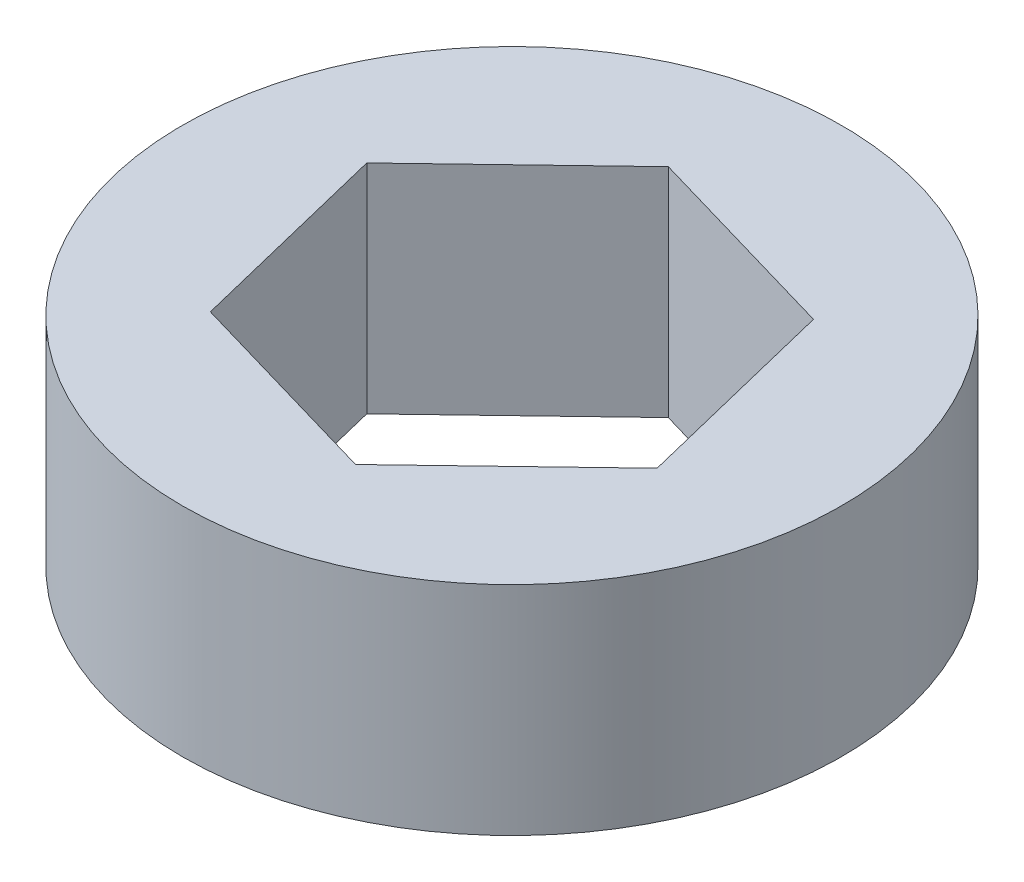
from build123d import *

# Parameters (mm, degrees)
SKETCH1_R           = 4.55
BOSS_EXTRUDE1_DEPTH = 3
CUT_EXTRUDE1_DEPTH  = 15


with BuildPart() as part:
    # Sketch1 → Boss-Extrude1 (new body)
    with BuildSketch(Plane(origin=(0, 0, 0), x_dir=(1, 0, 0), z_dir=(0, 1, 0))):
        Circle(SKETCH1_R)
    extrude(amount=BOSS_EXTRUDE1_DEPTH)

    # Sketch2 → Cut-Extrude1 (cut)
    with BuildSketch(Plane(origin=(0, 3, 0), x_dir=(1, 0, 0), z_dir=(0, 1, 0))):
        Polygon((-2.126350259, -2.036819721), (0.700762492, -2.859883202), (2.827112751, -0.823063481), (2.126350259, 2.036819721), (-0.700762492, 2.859883202), (-2.827112751, 0.823063481), align=None)
    extrude(amount=-CUT_EXTRUDE1_DEPTH, mode=Mode.SUBTRACT)


solid = part.part
